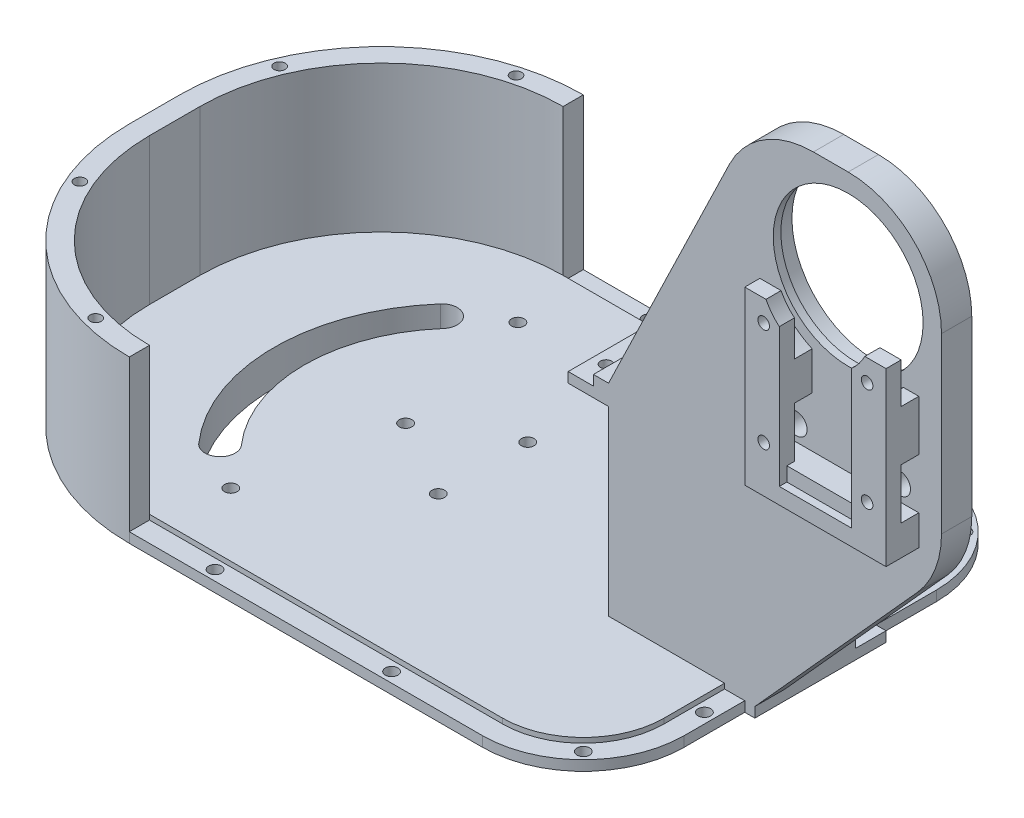
from build123d import *

# Parameters (mm, degrees)
SKETCH_1_R            = 40
EXTRUDE_1_DEPTH       = 4
CUT_EXTRUDE_1_DEPTH   = 2
SKETCH_3_W            = 130
SKETCH_3_H            = 90
EXTRUDE_2_DEPTH       = 3
FILLET_1_R            = 40
FILLET_2_R            = 20
SKETCH_6_W            = 4
SKETCH_6_H            = 26
EXTRUDE_3_DEPTH       = 43
EXTRUDE_START         = -32
EXTRUDE_4_DEPTH       = 32
CUT_EXTRUDE_2_DEPTH   = 98.046380664
SKETCH_10_W           = 25
SKETCH_10_H           = 6
EXTRUDE_5_DEPTH       = 40
EXTRUDE_6_DEPTH       = 6
FILLET_3_R            = 18.5
SKETCH_12_W           = 25
SKETCH_12_H           = 6
CUT_EXTRUDE_3_DEPTH   = 1
SKETCH_14_W           = 4
SKETCH_14_H           = 6
CUT_EXTRUDE_4_DEPTH   = 41
SKETCH_15_R           = 16.15
CUT_EXTRUDE_5_DEPTH   = 4.5
SKETCH_16_R           = 14.85
CUT_EXTRUDE_6_DEPTH   = 163.856531954
CHAMFER_1_SIZE        = 2.355852366
CHAMFER_1_SIZE_2      = 1
CUT_EXTRUDE_1_2_DEPTH = 1
SKETCH_18_W           = 28
SKETCH_18_H           = 6
EXTRUDE_7_DEPTH       = 6.5
SKETCH_19_W           = 14.3
SKETCH_19_H           = 2.8
CUT_EXTRUDE_7_DEPTH   = 1.5
SKETCH_20_W           = 6.85
SKETCH_20_H           = 3
EXTRUDE_8_DEPTH       = 28
CUT_EXTRUDE_8_REACH   = 167.802
SKETCH_22_R           = 1.15
CUT_EXTRUDE_9_REACH   = 163.351
SKETCH_23_R           = 2.1
CUT_EXTRUDE_START     = -3
SKETCH_24_R           = 11
CUT_EXTRUDE_10_DEPTH  = 3
EXTRUDE_9_DEPTH       = 4
SKETCH_27_W           = 5
SKETCH_27_H           = 26
CUT_EXTRUDE_11_DEPTH  = 2
SKETCH_29_R           = 1.85
EXTRUDE_10_DEPTH      = 3
CUT_EXTRUDE_12_REACH  = 135.229
SKETCH_28_R           = 1.1
SKETCH_30_R           = 1.1
CUT_EXTRUDE_13_DEPTH  = 10
CUT_EXTRUDE_14_REACH  = 158.573
SKETCH_31_R           = 1.25
SKETCH_32_R           = 1.1
CUT_EXTRUDE_15_DEPTH  = 8
SKETCH_33_R           = 1.25
CUT_EXTRUDE_16_DEPTH  = 158.895535221


with BuildPart() as part:
    # 스케치1 → 보스-돌출1 (new body)
    with BuildSketch(Plane(origin=(0, 0, 0), x_dir=(1, 0, 0), z_dir=(0, 1, 0))):
        with Locations(Location((0, 0, 0), (0, 0, 270))):
            Circle(SKETCH_1_R)
    extrude(amount=EXTRUDE_1_DEPTH)

    # 스케치2 → Cut-Extrude 1 (cut)
    with BuildSketch(Plane.XZ):
        with BuildLine():
            Line((-22.541766007, 33.043437855), (-15.351057363, -1.1854e-05))
            Line((-15.351057363, -1.1854e-05), (-22.541714974, -33.043472669))
            ThreePointArc((-22.541714974, -33.043472669), (-19.999976313, -34.641029827), (-17.345579981, -36.043457869))
            Line((-17.345579981, -36.043457869), (7.675538375, -13.294399465))
            Line((7.675538375, -13.294399465), (39.887344635, -2.999956329))
            ThreePointArc((39.887344635, -2.999956329), (40, 2.7352e-05), (39.887340532, 3.000010878))
            Line((39.887340532, 3.000010878), (7.67552116, 13.294409653))
            Line((7.67552116, 13.294409653), (-17.34562462, 36.043436386))
            ThreePointArc((-17.34562462, 36.043436386), (-20.000024514, 34.641001998), (-22.541766007, 33.043437855))
        make_face()
    extrude(amount=-CUT_EXTRUDE_1_DEPTH, mode=Mode.SUBTRACT)

    # 스케치3 → 보스-돌출2 (add)
    with BuildSketch(Plane(origin=(0, 4, 0), x_dir=(1, 0, 0), z_dir=(0, 1, 0))):
        with Locations((5, 0)):
            Rectangle(SKETCH_3_W, SKETCH_3_H)
    extrude(amount=EXTRUDE_2_DEPTH)

    # 필렛1
    fillet_1_edges = [part.edges().sort_by_distance(p)[0] for p in [
        (-60, 5.5, -45),
        (-60, 5.5, 45),
    ]]
    fillet(fillet_1_edges, radius=FILLET_1_R)

    # 필렛2
    fillet_2_edges = [part.edges().sort_by_distance(p)[0] for p in [
        (70, 5.5, 45),
        (70, 5.5, -45),
    ]]
    fillet(fillet_2_edges, radius=FILLET_2_R)

    # 스케치6 → 보스-돌출3 (add)
    with BuildSketch(Plane.XZ.offset(-4)):
        with Locations((70, 0)):
            Rectangle(SKETCH_6_W, SKETCH_6_H)
    extrude(amount=-EXTRUDE_3_DEPTH)

    # 스케치7 → 보스-돌출4 (add)
    with BuildSketch(Plane.XZ.offset(-4).offset(EXTRUDE_START)):
        with BuildLine():
            Line((-20, -45), (-20, -41))
            ThreePointArc((-20, -41), (-45.455844123, -30.455844123), (-56, -5))
            Line((-56, -5), (-56, 5))
            ThreePointArc((-56, 5), (-45.455844123, 30.455844123), (-20, 41))
            Line((-20, 41), (-20, 45))
            ThreePointArc((-20, 45), (-48.284271247, 33.284271247), (-60, 5))
            Line((-60, 5), (-60, -5))
            ThreePointArc((-60, -5), (-48.284271247, -33.284271247), (-20, -45))
        make_face()
    extrude(amount=EXTRUDE_4_DEPTH)

    # 스케치9 → 컷-돌출2 (cut, through all)
    with BuildSketch(Plane.XZ):
        with BuildLine():
            ThreePointArc((-27.252140551, 23.981883685), (-36.301651611, 0), (-27.252140551, -23.981883685))
            ThreePointArc((-27.252140551, -23.981883685), (-23.018116315, -24.252140551), (-22.747859449, -20.018116315))
            ThreePointArc((-22.747859449, -20.018116315), (-30.301651611, 0), (-22.747859449, 20.018116315))
            ThreePointArc((-22.747859449, 20.018116315), (-23.018116315, 24.252140551), (-27.252140551, 23.981883685))
        make_face()
    extrude(amount=-CUT_EXTRUDE_2_DEPTH, mode=Mode.SUBTRACT)

    # 스케치10 → 보스-돌출5 (add)
    with BuildSketch(Plane(origin=(0, 7, 0), x_dir=(1, 0, 0), z_dir=(0, 1, 0))):
        with Locations((55.5, -10)):
            Rectangle(SKETCH_10_W, SKETCH_10_H)
    extrude(amount=EXTRUDE_5_DEPTH)

    # 스케치11 → 보스-돌출6 (add)
    with BuildSketch(Plane(origin=(0, 0, 7), x_dir=(-1, 0, 0), z_dir=(0, 0, -1))):
        Polygon((-109, 47), (-72, 6), (-43, 47), (-72, 107), (-109, 107), align=None)
    extrude(amount=-EXTRUDE_6_DEPTH)

    # 필렛3
    fillet_3_edges = [part.edges().sort_by_distance(p)[0] for p in [
        (109, 47, 10),
        (109, 107, 10),
        (72, 107, 10),
    ]]
    fillet(fillet_3_edges, radius=FILLET_3_R)

    # 스케치12 → 컷-돌출3 (cut)
    with BuildSketch(Plane(origin=(0, 7, 0), x_dir=(1, 0, 0), z_dir=(0, 1, 0))):
        with Locations((55.5, 10)):
            Rectangle(SKETCH_12_W, SKETCH_12_H)
    extrude(amount=-CUT_EXTRUDE_3_DEPTH, mode=Mode.SUBTRACT)

    # 스케치14 → 컷-돌출4 (cut)
    with BuildSketch(Plane(origin=(0, 47, 0), x_dir=(1, 0, 0), z_dir=(0, 1, 0))):
        with Locations((70, 10)):
            Rectangle(SKETCH_14_W, SKETCH_14_H)
    extrude(amount=-CUT_EXTRUDE_4_DEPTH, mode=Mode.SUBTRACT)

    # 스케치15 → 컷-돌출5 (cut)
    with BuildSketch(Plane(origin=(0, 0, 7), x_dir=(-1, 0, 0), z_dir=(0, 0, -1))):
        with Locations((-90.5, 88.5)):
            Circle(SKETCH_15_R)
    extrude(amount=-CUT_EXTRUDE_5_DEPTH, mode=Mode.SUBTRACT)

    # 스케치16 → 컷-돌출6 (cut, through all)
    with BuildSketch(Plane(origin=(0, 0, 11.5), x_dir=(-1, 0, 0), z_dir=(0, 0, -1))):
        with Locations((-90.5, 88.5)):
            Circle(SKETCH_16_R)
    extrude(amount=-CUT_EXTRUDE_6_DEPTH, mode=Mode.SUBTRACT)

    # 모따기1
    # the kernel refuses this chamfer: 2.355852366, 1 mm, written as the material it takes off along each edge
    with BuildSketch(Plane(origin=(90.5, 88.5, 7), x_dir=(-1, 0, 0), z_dir=(0, -1, 0))) as chamfer_1_piece_1:
        Polygon((16.15 + CHAMFER_1_SIZE, 0), (16.15, -CHAMFER_1_SIZE_2), (16.15, 0), align=None)
    revolve(axis=Axis((90.5, 88.5, 7), (0, 0, -1)), mode=Mode.SUBTRACT)

    # 스케치17 → Cut-Extrude 1 2 (cut)
    with BuildSketch(Plane(origin=(0, 7, 0), x_dir=(1, 0, 0), z_dir=(0, 1, 0))):
        with BuildLine():
            Line((66, 13), (66, 25))
            ThreePointArc((66, 25), (61.313708499, 36.313708499), (50, 41))
            Line((50, 41), (-20, 41))
            Line((-20, 41), (-20, 51))
            Line((-20, 51), (50, 51))
            ThreePointArc((50, 51), (68.384776311, 43.384776311), (76, 25))
            Line((76, 25), (76, 13))
            Line((76, 13), (66, 13))
        make_face()
        with BuildLine():
            Line((-20, -41), (50, -41))
            ThreePointArc((50, -41), (61.313708499, -36.313708499), (66, -25))
            Line((66, -25), (66, -13))
            Line((66, -13), (76, -13))
            Line((76, -13), (76, -25))
            ThreePointArc((76, -25), (68.384776311, -43.384776311), (50, -51))
            Line((50, -51), (-20, -51))
            Line((-20, -51), (-20, -41))
        make_face()
    extrude(amount=-CUT_EXTRUDE_1_2_DEPTH, mode=Mode.SUBTRACT)

    # 스케치18 → 보스-돌출7 (add)
    with BuildSketch(Plane.XY.offset(13)):
        with Locations((90.5, 52.5)):
            Rectangle(SKETCH_18_W, SKETCH_18_H)
        with BuildLine():
            Line((76.5, 65.5), (83.35, 65.5))
            Line((83.35, 65.5), (83.35, 73.076722138))
            ThreePointArc((83.35, 73.076722138), (81.367045562, 74.161619923), (79.54554885, 75.5))
            Line((79.54554885, 75.5), (76.5, 75.5))
            Line((76.5, 75.5), (76.5, 65.5))
        make_face()
        with BuildLine():
            Line((104.5, 65.5), (97.65, 65.5))
            Line((97.65, 65.5), (97.65, 73.076722138))
            ThreePointArc((97.65, 73.076722138), (99.632954438, 74.161619923), (101.45445115, 75.5))
            Line((101.45445115, 75.5), (104.5, 75.5))
            Line((104.5, 75.5), (104.5, 65.5))
        make_face()
    extrude(amount=EXTRUDE_7_DEPTH)

    # 스케치19 → 컷-돌출7 (cut)
    with BuildSketch(Plane.XY.offset(19.5)):
        with Locations((90.5, 54.1)):
            Rectangle(SKETCH_19_W, SKETCH_19_H)
    extrude(amount=-CUT_EXTRUDE_7_DEPTH, mode=Mode.SUBTRACT)

    # 스케치20 → 보스-돌출8 (add)
    with BuildSketch(Plane(origin=(0, 55.5, 0), x_dir=(1, 0, 0), z_dir=(0, 1, 0))):
        with Locations((101.075, -18)):
            Rectangle(SKETCH_20_W, SKETCH_20_H)
        with Locations((79.925, -18)):
            Rectangle(SKETCH_20_W, SKETCH_20_H)
    extrude(amount=EXTRUDE_8_DEPTH)

    # 스케치22 → 컷-돌출8 (cut, up to next)
    with BuildSketch(Plane.XY.offset(19.5), mode=Mode.PRIVATE) as cut_extrude_8_sk1:
        with Locations((80.25, 79.2)):
            Circle(SKETCH_22_R)
    cut_extrude_8_tool1 = extrude(cut_extrude_8_sk1.sketch, amount=-CUT_EXTRUDE_8_REACH, mode=Mode.PRIVATE) & part.part
    # 스케치22 → 컷-돌출8 (cut, up to next)
    with BuildSketch(Plane.XY.offset(19.5), mode=Mode.PRIVATE) as cut_extrude_8_sk2:
        with Locations((100.75, 79.2)):
            Circle(SKETCH_22_R)
    cut_extrude_8_tool2 = extrude(cut_extrude_8_sk2.sketch, amount=-CUT_EXTRUDE_8_REACH, mode=Mode.PRIVATE) & part.part
    # 스케치22 → 컷-돌출8 (cut, up to next)
    with BuildSketch(Plane.XY.offset(19.5), mode=Mode.PRIVATE) as cut_extrude_8_sk3:
        with Locations((80.25, 58.7)):
            Circle(SKETCH_22_R)
    cut_extrude_8_tool3 = extrude(cut_extrude_8_sk3.sketch, amount=-CUT_EXTRUDE_8_REACH, mode=Mode.PRIVATE) & part.part
    # 스케치22 → 컷-돌출8 (cut, up to next)
    with BuildSketch(Plane.XY.offset(19.5), mode=Mode.PRIVATE) as cut_extrude_8_sk4:
        with Locations((100.75, 58.7)):
            Circle(SKETCH_22_R)
    cut_extrude_8_tool4 = extrude(cut_extrude_8_sk4.sketch, amount=-CUT_EXTRUDE_8_REACH, mode=Mode.PRIVATE) & part.part
    add(cut_extrude_8_tool1.solids().sort_by_distance((80.25, 79.2, 19.5))[0], mode=Mode.SUBTRACT)
    add(cut_extrude_8_tool2.solids().sort_by_distance((100.75, 79.2, 19.5))[0], mode=Mode.SUBTRACT)
    add(cut_extrude_8_tool3.solids().sort_by_distance((80.25, 58.7, 19.5))[0], mode=Mode.SUBTRACT)
    add(cut_extrude_8_tool4.solids().sort_by_distance((100.75, 58.7, 19.5))[0], mode=Mode.SUBTRACT)

    # 스케치23 → 컷-돌출9 (cut, up to next)
    with BuildSketch(Plane(origin=(0, 0, 7), x_dir=(-1, 0, 0), z_dir=(0, 0, -1)), mode=Mode.PRIVATE) as cut_extrude_9_sk1:
        with Locations((-80.25, 58.7)):
            Circle(SKETCH_23_R)
    cut_extrude_9_tool1 = extrude(cut_extrude_9_sk1.sketch, amount=-CUT_EXTRUDE_9_REACH, mode=Mode.PRIVATE) & part.part
    # 스케치23 → 컷-돌출9 (cut, up to next)
    with BuildSketch(Plane(origin=(0, 0, 7), x_dir=(-1, 0, 0), z_dir=(0, 0, -1)), mode=Mode.PRIVATE) as cut_extrude_9_sk2:
        with Locations((-100.75, 58.7)):
            Circle(SKETCH_23_R)
    cut_extrude_9_tool2 = extrude(cut_extrude_9_sk2.sketch, amount=-CUT_EXTRUDE_9_REACH, mode=Mode.PRIVATE) & part.part
    add(cut_extrude_9_tool1.solids().sort_by_distance((80.25, 58.7, 7))[0], mode=Mode.SUBTRACT)
    add(cut_extrude_9_tool2.solids().sort_by_distance((100.75, 58.7, 7))[0], mode=Mode.SUBTRACT)

    # 스케치24 → 컷-돌출10 (cut)
    with BuildSketch(Plane.XY.offset(19.5).offset(CUT_EXTRUDE_START)):
        with Locations((90.5, 88.5)):
            Circle(SKETCH_24_R)
    extrude(amount=CUT_EXTRUDE_10_DEPTH, mode=Mode.SUBTRACT)

    # 스케치25 → 보스-돌출9 (add)
    with BuildSketch(Plane(origin=(0, 47, 0), x_dir=(1, 0, 0), z_dir=(0, 1, 0))):
        Polygon((43, 13), (35, 13), (35, -13), (72, -13), (72, 7), (43, 7), align=None)
    extrude(amount=-EXTRUDE_9_DEPTH)

    # 스케치27 → 컷-돌출11 (cut)
    with BuildSketch(Plane(origin=(0, 47, 0), x_dir=(1, 0, 0), z_dir=(0, 1, 0))):
        with Locations((37.5, 0)):
            Rectangle(SKETCH_27_W, SKETCH_27_H)
    extrude(amount=-CUT_EXTRUDE_11_DEPTH, mode=Mode.SUBTRACT)

    # 스케치29 → 보스-돌출10 (add)
    with BuildSketch(Plane.XZ.offset(-43)):
        with Locations(Location((37.5, 8, 0), (0, 0, 270))):
            Circle(SKETCH_29_R)
        with Locations(Location((37.5, -8, 0), (0, 0, 270))):
            Circle(SKETCH_29_R)
    extrude(amount=EXTRUDE_10_DEPTH)

    # 스케치28 → 컷-돌출12 (cut, up to next)
    with BuildSketch(Plane(origin=(0, 45, 0), x_dir=(1, 0, 0), z_dir=(0, 1, 0)), mode=Mode.PRIVATE) as cut_extrude_12_sk1:
        with Locations(Location((37.5, 8, 0), (0, 0, 270))):
            Circle(SKETCH_28_R)
    cut_extrude_12_tool1 = extrude(cut_extrude_12_sk1.sketch, amount=-CUT_EXTRUDE_12_REACH, mode=Mode.PRIVATE) & part.part
    # 스케치28 → 컷-돌출12 (cut, up to next)
    with BuildSketch(Plane(origin=(0, 45, 0), x_dir=(1, 0, 0), z_dir=(0, 1, 0)), mode=Mode.PRIVATE) as cut_extrude_12_sk2:
        with Locations(Location((37.5, -8, 0), (0, 0, 270))):
            Circle(SKETCH_28_R)
    cut_extrude_12_tool2 = extrude(cut_extrude_12_sk2.sketch, amount=-CUT_EXTRUDE_12_REACH, mode=Mode.PRIVATE) & part.part
    add(cut_extrude_12_tool1.solids().sort_by_distance((37.5, 45, -8))[0], mode=Mode.SUBTRACT)
    add(cut_extrude_12_tool2.solids().sort_by_distance((37.5, 45, 8))[0], mode=Mode.SUBTRACT)

    # 스케치30 → 컷-돌출13 (cut)
    with BuildSketch(Plane(origin=(0, 36, 0), x_dir=(1, 0, 0), z_dir=(0, 1, 0))):
        with Locations(Location((-30, -41.66060556, 0), (0, 0, 270))):
            Circle(SKETCH_30_R)
        with Locations(Location((-30, 41.66060556, 0), (0, 0, 270))):
            Circle(SKETCH_30_R)
        with Locations(Location((-55, 19.798648587, 0), (0, 0, 270))):
            Circle(SKETCH_30_R)
        with Locations(Location((-55, -19.798648587, 0), (0, 0, 270))):
            Circle(SKETCH_30_R)
    extrude(amount=-CUT_EXTRUDE_13_DEPTH, mode=Mode.SUBTRACT)

    # 스케치31 → 컷-돌출14 (cut, up to next)
    with BuildSketch(Plane.XZ.offset(-4), mode=Mode.PRIVATE) as cut_extrude_14_sk1:
        with Locations(Location((-5, 43, 0), (0, 0, 270))):
            Circle(SKETCH_31_R)
    cut_extrude_14_tool1 = extrude(cut_extrude_14_sk1.sketch, amount=-CUT_EXTRUDE_14_REACH, mode=Mode.PRIVATE) & part.part
    # 스케치31 → 컷-돌출14 (cut, up to next)
    with BuildSketch(Plane.XZ.offset(-4), mode=Mode.PRIVATE) as cut_extrude_14_sk2:
        with Locations(Location((30, 43, 0), (0, 0, 270))):
            Circle(SKETCH_31_R)
    cut_extrude_14_tool2 = extrude(cut_extrude_14_sk2.sketch, amount=-CUT_EXTRUDE_14_REACH, mode=Mode.PRIVATE) & part.part
    # 스케치31 → 컷-돌출14 (cut, up to next)
    with BuildSketch(Plane.XZ.offset(-4), mode=Mode.PRIVATE) as cut_extrude_14_sk3:
        with Locations(Location((30, -43, 0), (0, 0, 270))):
            Circle(SKETCH_31_R)
    cut_extrude_14_tool3 = extrude(cut_extrude_14_sk3.sketch, amount=-CUT_EXTRUDE_14_REACH, mode=Mode.PRIVATE) & part.part
    # 스케치31 → 컷-돌출14 (cut, up to next)
    with BuildSketch(Plane.XZ.offset(-4), mode=Mode.PRIVATE) as cut_extrude_14_sk4:
        with Locations(Location((-5, -43, 0), (0, 0, 270))):
            Circle(SKETCH_31_R)
    cut_extrude_14_tool4 = extrude(cut_extrude_14_sk4.sketch, amount=-CUT_EXTRUDE_14_REACH, mode=Mode.PRIVATE) & part.part
    # 스케치31 → 컷-돌출14 (cut, up to next)
    with BuildSketch(Plane.XZ.offset(-4), mode=Mode.PRIVATE) as cut_extrude_14_sk5:
        with Locations(Location((68, -19, 0), (0, 0, 270))):
            Circle(SKETCH_31_R)
    cut_extrude_14_tool5 = extrude(cut_extrude_14_sk5.sketch, amount=-CUT_EXTRUDE_14_REACH, mode=Mode.PRIVATE) & part.part
    # 스케치31 → 컷-돌출14 (cut, up to next)
    with BuildSketch(Plane.XZ.offset(-4), mode=Mode.PRIVATE) as cut_extrude_14_sk6:
        with Locations(Location((68, 19, 0), (0, 0, 270))):
            Circle(SKETCH_31_R)
    cut_extrude_14_tool6 = extrude(cut_extrude_14_sk6.sketch, amount=-CUT_EXTRUDE_14_REACH, mode=Mode.PRIVATE) & part.part
    # 스케치31 → 컷-돌출14 (cut, up to next)
    with BuildSketch(Plane.XZ.offset(-4), mode=Mode.PRIVATE) as cut_extrude_14_sk7:
        with Locations(Location((62.727922061, 37.727922061, 0), (0, 0, 270))):
            Circle(SKETCH_31_R)
    cut_extrude_14_tool7 = extrude(cut_extrude_14_sk7.sketch, amount=-CUT_EXTRUDE_14_REACH, mode=Mode.PRIVATE) & part.part
    # 스케치31 → 컷-돌출14 (cut, up to next)
    with BuildSketch(Plane.XZ.offset(-4), mode=Mode.PRIVATE) as cut_extrude_14_sk8:
        with Locations(Location((62.727922061, -37.727922061, 0), (0, 0, 270))):
            Circle(SKETCH_31_R)
    cut_extrude_14_tool8 = extrude(cut_extrude_14_sk8.sketch, amount=-CUT_EXTRUDE_14_REACH, mode=Mode.PRIVATE) & part.part
    # 스케치31 → 컷-돌출14 (cut, up to next)
    with BuildSketch(Plane.XZ.offset(-4), mode=Mode.PRIVATE) as cut_extrude_14_sk9:
        with Locations(Location((48, -10, 0), (0, 0, 270))):
            Circle(SKETCH_31_R)
    cut_extrude_14_tool9 = extrude(cut_extrude_14_sk9.sketch, amount=-CUT_EXTRUDE_14_REACH, mode=Mode.PRIVATE) & part.part
    # 스케치31 → 컷-돌출14 (cut, up to next)
    with BuildSketch(Plane.XZ.offset(-4), mode=Mode.PRIVATE) as cut_extrude_14_sk10:
        with Locations(Location((65.5, -10, 0), (0, 0, 270))):
            Circle(SKETCH_31_R)
    cut_extrude_14_tool10 = extrude(cut_extrude_14_sk10.sketch, amount=-CUT_EXTRUDE_14_REACH, mode=Mode.PRIVATE) & part.part
    add(cut_extrude_14_tool1.solids().sort_by_distance((-5, 4, 43))[0], mode=Mode.SUBTRACT)
    add(cut_extrude_14_tool2.solids().sort_by_distance((30, 4, 43))[0], mode=Mode.SUBTRACT)
    add(cut_extrude_14_tool3.solids().sort_by_distance((30, 4, -43))[0], mode=Mode.SUBTRACT)
    add(cut_extrude_14_tool4.solids().sort_by_distance((-5, 4, -43))[0], mode=Mode.SUBTRACT)
    add(cut_extrude_14_tool5.solids().sort_by_distance((68, 4, -19))[0], mode=Mode.SUBTRACT)
    add(cut_extrude_14_tool6.solids().sort_by_distance((68, 4, 19))[0], mode=Mode.SUBTRACT)
    add(cut_extrude_14_tool7.solids().sort_by_distance((62.727922, 4, 37.727922))[0], mode=Mode.SUBTRACT)
    add(cut_extrude_14_tool8.solids().sort_by_distance((62.727922, 4, -37.727922))[0], mode=Mode.SUBTRACT)
    add(cut_extrude_14_tool9.solids().sort_by_distance((48, 4, -10))[0], mode=Mode.SUBTRACT)
    add(cut_extrude_14_tool10.solids().sort_by_distance((65.5, 4, -10))[0], mode=Mode.SUBTRACT)

    # 스케치32 → 컷-돌출15 (cut)
    with BuildSketch(Plane(origin=(0, 0, -7), x_dir=(-1, 0, 0), z_dir=(0, 0, -1))):
        with Locations((-53, 45)):
            Circle(SKETCH_32_R)
        with Locations((-70, 35)):
            Circle(SKETCH_32_R)
        with Locations((-70, 15)):
            Circle(SKETCH_32_R)
    extrude(amount=-CUT_EXTRUDE_15_DEPTH, mode=Mode.SUBTRACT)

    # 스케치33 → 컷-돌출16 (cut, through all)
    with BuildSketch(Plane.XZ.offset(-2)):
        with Locations(Location((-16.424853723, 28.448634662, 0), (0, 0, 270))):
            Circle(SKETCH_33_R)
        with Locations(Location((32.84963819, 2.2462e-05, 0), (0, 0, 270))):
            Circle(SKETCH_33_R)
        with Locations(Location((-16.424806277, -28.448643901, 0), (0, 0, 270))):
            Circle(SKETCH_33_R)
        with Locations(Location((-10.234038242, -7.903e-06, 0), (0, 0, 270))):
            Circle(SKETCH_33_R)
        with Locations(Location((5.117014106, 8.862939769, 0), (0, 0, 270))):
            Circle(SKETCH_33_R)
        with Locations(Location((5.117025583, -8.862932977, 0), (0, 0, 270))):
            Circle(SKETCH_33_R)
    extrude(amount=-CUT_EXTRUDE_16_DEPTH, mode=Mode.SUBTRACT)


solid = part.part
